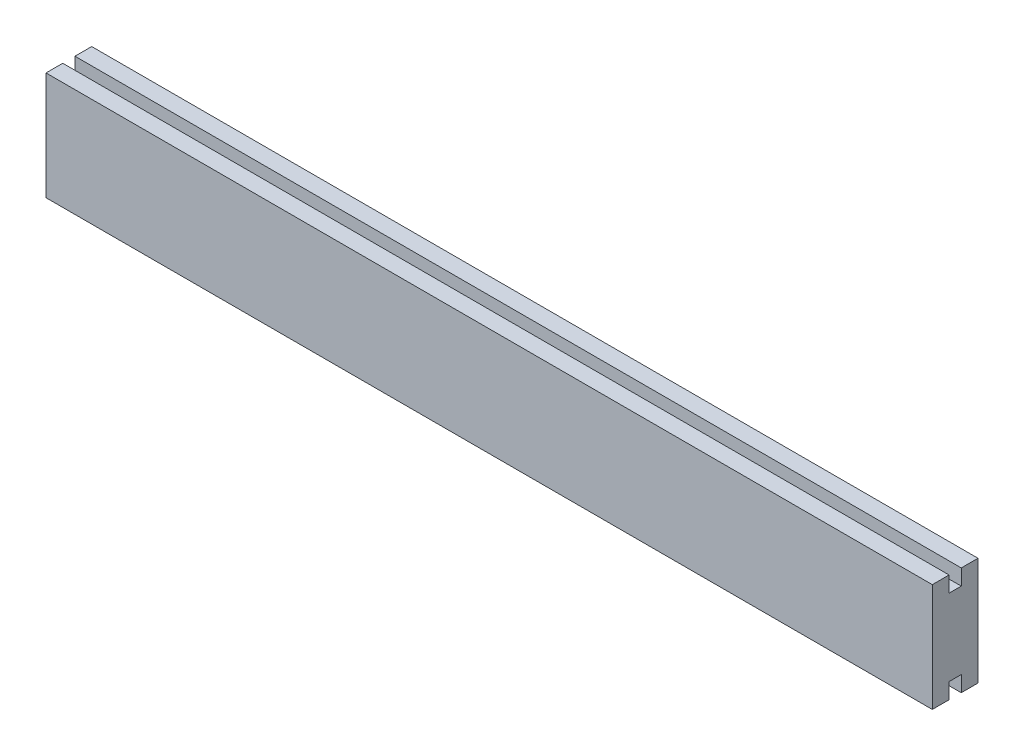
from build123d import *

# Parameters (mm, degrees)
BOSS_EXTRUDE1_DEPTH = 450
FILL_START          = -23.2
FILL_PATTERN1_DEPTH = 23.2
BOSS_EXTRUDE2_START = -443.27911
SKETCH2_W           = 1
SKETCH2_H           = 54.89
BOSS_EXTRUDE2_DEPTH = 436.55822


# Read off the part's stored shape, not the designer's step: Fill Pattern1
with BuildPart() as part:
    # Sketch1 → Boss-Extrude1 (new body)
    with BuildSketch(Plane(origin=(0, 0, 0), x_dir=(0, 0, -1), z_dir=(1, 0, 0))):
        Polygon((0, 0), (0, 54.89), (8.5, 54.89), (8.5, 46.89), (14.7, 46.89), (14.7, 54.89), (23.2, 54.89), (23.2, 0), (14.7, 0), (14.7, 8), (8.5, 8), (8.5, 0), align=None)
    extrude(amount=BOSS_EXTRUDE1_DEPTH)

    # Fill Pattern1 outline → Fill Pattern1 (cut)
    with BuildSketch(Plane.XY.offset(FILL_START)):
        Polygon((438.27910961, 28.034745962), (443.27910961, 36.695), (438.27910961, 45.355254038), (428.27910961, 45.355254038), (423.27910961, 36.695), (428.27910961, 28.034745962), align=None)
        Polygon((139.89265015, 28.034745962), (149.89265015, 28.034745962), (154.89265015, 36.695), (149.89265015, 45.355254038), (139.89265015, 45.355254038), (134.89265015, 36.695), align=None)
        Polygon((107.84971021, 28.034745962), (117.84971021, 28.034745962), (122.84971021, 36.695), (117.84971021, 45.355254038), (107.84971021, 45.355254038), (102.84971021, 36.695), align=None)
        Polygon((75.80677027, 28.034745962), (85.80677027, 28.034745962), (90.80677027, 36.695), (85.80677027, 45.355254038), (75.80677027, 45.355254038), (70.80677027, 36.695), align=None)
        Polygon((43.76383033, 28.034745962), (53.76383033, 28.034745962), (58.76383033, 36.695), (53.76383033, 45.355254038), (43.76383033, 45.355254038), (38.76383033, 36.695), align=None)
        Polygon((11.72089039, 28.034745962), (21.72089039, 28.034745962), (26.72089039, 36.695), (21.72089039, 45.355254038), (11.72089039, 45.355254038), (6.72089039, 36.695), align=None)
        Polygon((171.93559009, 28.034745962), (181.93559009, 28.034745962), (186.93559009, 36.695), (181.93559009, 45.355254038), (171.93559009, 45.355254038), (166.93559009, 36.695), align=None)
        Polygon((203.97853003, 28.034745962), (213.97853003, 28.034745962), (218.97853003, 36.695), (213.97853003, 45.355254038), (203.97853003, 45.355254038), (198.97853003, 36.695), align=None)
        Polygon((236.02146997, 28.034745962), (246.02146997, 28.034745962), (251.02146997, 36.695), (246.02146997, 45.355254038), (236.02146997, 45.355254038), (231.02146997, 36.695), align=None)
        Polygon((268.06440991, 28.034745962), (278.06440991, 28.034745962), (283.06440991, 36.695), (278.06440991, 45.355254038), (268.06440991, 45.355254038), (263.06440991, 36.695), align=None)
        Polygon((300.10734985, 28.034745962), (310.10734985, 28.034745962), (315.10734985, 36.695), (310.10734985, 45.355254038), (300.10734985, 45.355254038), (295.10734985, 36.695), align=None)
        Polygon((332.15028979, 28.034745962), (342.15028979, 28.034745962), (347.15028979, 36.695), (342.15028979, 45.355254038), (332.15028979, 45.355254038), (327.15028979, 36.695), align=None)
        Polygon((364.19322973, 28.034745962), (374.19322973, 28.034745962), (379.19322973, 36.695), (374.19322973, 45.355254038), (364.19322973, 45.355254038), (359.19322973, 36.695), align=None)
        Polygon((396.23616967, 28.034745962), (406.23616967, 28.034745962), (411.23616967, 36.695), (406.23616967, 45.355254038), (396.23616967, 45.355254038), (391.23616967, 36.695), align=None)
        Polygon((53.76383033, 9.534745962), (58.76383033, 18.195), (53.76383033, 26.855254038), (43.76383033, 26.855254038), (38.76383033, 18.195), (43.76383033, 9.534745962), align=None)
        Polygon((75.80677027, 9.534745962), (85.80677027, 9.534745962), (90.80677027, 18.195), (85.80677027, 26.855254038), (75.80677027, 26.855254038), (70.80677027, 18.195), align=None)
        Polygon((107.84971021, 9.534745962), (117.84971021, 9.534745962), (122.84971021, 18.195), (117.84971021, 26.855254038), (107.84971021, 26.855254038), (102.84971021, 18.195), align=None)
        Polygon((139.89265015, 9.534745962), (149.89265015, 9.534745962), (154.89265015, 18.195), (149.89265015, 26.855254038), (139.89265015, 26.855254038), (134.89265015, 18.195), align=None)
        Polygon((171.93559009, 9.534745962), (181.93559009, 9.534745962), (186.93559009, 18.195), (181.93559009, 26.855254038), (171.93559009, 26.855254038), (166.93559009, 18.195), align=None)
        Polygon((203.97853003, 9.534745962), (213.97853003, 9.534745962), (218.97853003, 18.195), (213.97853003, 26.855254038), (203.97853003, 26.855254038), (198.97853003, 18.195), align=None)
        Polygon((236.02146997, 9.534745962), (246.02146997, 9.534745962), (251.02146997, 18.195), (246.02146997, 26.855254038), (236.02146997, 26.855254038), (231.02146997, 18.195), align=None)
        Polygon((268.06440991, 9.534745962), (278.06440991, 9.534745962), (283.06440991, 18.195), (278.06440991, 26.855254038), (268.06440991, 26.855254038), (263.06440991, 18.195), align=None)
        Polygon((11.72089039, 9.534745962), (21.72089039, 9.534745962), (26.72089039, 18.195), (21.72089039, 26.855254038), (11.72089039, 26.855254038), (6.72089039, 18.195), align=None)
        Polygon((428.27910961, 9.534745962), (438.27910961, 9.534745962), (443.27910961, 18.195), (438.27910961, 26.855254038), (428.27910961, 26.855254038), (423.27910961, 18.195), align=None)
        Polygon((396.23616967, 9.534745962), (406.23616967, 9.534745962), (411.23616967, 18.195), (406.23616967, 26.855254038), (396.23616967, 26.855254038), (391.23616967, 18.195), align=None)
        Polygon((364.19322973, 9.534745962), (374.19322973, 9.534745962), (379.19322973, 18.195), (374.19322973, 26.855254038), (364.19322973, 26.855254038), (359.19322973, 18.195), align=None)
        Polygon((332.15028979, 9.534745962), (342.15028979, 9.534745962), (347.15028979, 18.195), (342.15028979, 26.855254038), (332.15028979, 26.855254038), (327.15028979, 18.195), align=None)
        Polygon((300.10734985, 9.534745962), (310.10734985, 9.534745962), (315.10734985, 18.195), (310.10734985, 26.855254038), (300.10734985, 26.855254038), (295.10734985, 18.195), align=None)
        Polygon((422.25763964, 18.784745962), (427.25763964, 27.445), (422.25763964, 36.105254038), (412.25763964, 36.105254038), (407.25763964, 27.445), (412.25763964, 18.784745962), align=None)
        Polygon((380.2146997, 18.784745962), (390.2146997, 18.784745962), (395.2146997, 27.445), (390.2146997, 36.105254038), (380.2146997, 36.105254038), (375.2146997, 27.445), align=None)
        Polygon((27.74236036, 18.784745962), (37.74236036, 18.784745962), (42.74236036, 27.445), (37.74236036, 36.105254038), (27.74236036, 36.105254038), (22.74236036, 27.445), align=None)
        Polygon((59.7853003, 18.784745962), (69.7853003, 18.784745962), (74.7853003, 27.445), (69.7853003, 36.105254038), (59.7853003, 36.105254038), (54.7853003, 27.445), align=None)
        Polygon((91.82824024, 18.784745962), (101.82824024, 18.784745962), (106.82824024, 27.445), (101.82824024, 36.105254038), (91.82824024, 36.105254038), (86.82824024, 27.445), align=None)
        Polygon((123.87118018, 18.784745962), (133.87118018, 18.784745962), (138.87118018, 27.445), (133.87118018, 36.105254038), (123.87118018, 36.105254038), (118.87118018, 27.445), align=None)
        Polygon((155.91412012, 18.784745962), (165.91412012, 18.784745962), (170.91412012, 27.445), (165.91412012, 36.105254038), (155.91412012, 36.105254038), (150.91412012, 27.445), align=None)
        Polygon((187.95706006, 18.784745962), (197.95706006, 18.784745962), (202.95706006, 27.445), (197.95706006, 36.105254038), (187.95706006, 36.105254038), (182.95706006, 27.445), align=None)
        Polygon((220, 18.784745962), (230, 18.784745962), (235, 27.445), (230, 36.105254038), (220, 36.105254038), (215, 27.445), align=None)
        Polygon((252.04293994, 18.784745962), (262.04293994, 18.784745962), (267.04293994, 27.445), (262.04293994, 36.105254038), (252.04293994, 36.105254038), (247.04293994, 27.445), align=None)
        Polygon((284.08587988, 18.784745962), (294.08587988, 18.784745962), (299.08587988, 27.445), (294.08587988, 36.105254038), (284.08587988, 36.105254038), (279.08587988, 27.445), align=None)
        Polygon((316.12881982, 18.784745962), (326.12881982, 18.784745962), (331.12881982, 27.445), (326.12881982, 36.105254038), (316.12881982, 36.105254038), (311.12881982, 27.445), align=None)
        Polygon((348.17175976, 18.784745962), (358.17175976, 18.784745962), (363.17175976, 27.445), (358.17175976, 36.105254038), (348.17175976, 36.105254038), (343.17175976, 27.445), align=None)
    extrude(amount=FILL_PATTERN1_DEPTH, mode=Mode.SUBTRACT)

    # Sketch2 → Boss-Extrude2 (add)
    with BuildSketch(Plane.ZY.offset(BOSS_EXTRUDE2_START)):
        with Locations((-22.7, 27.445)):
            Rectangle(SKETCH2_W, SKETCH2_H)
        with Locations((-0.5, 27.445)):
            Rectangle(SKETCH2_W, SKETCH2_H)
    extrude(amount=BOSS_EXTRUDE2_DEPTH)


solid = part.part
